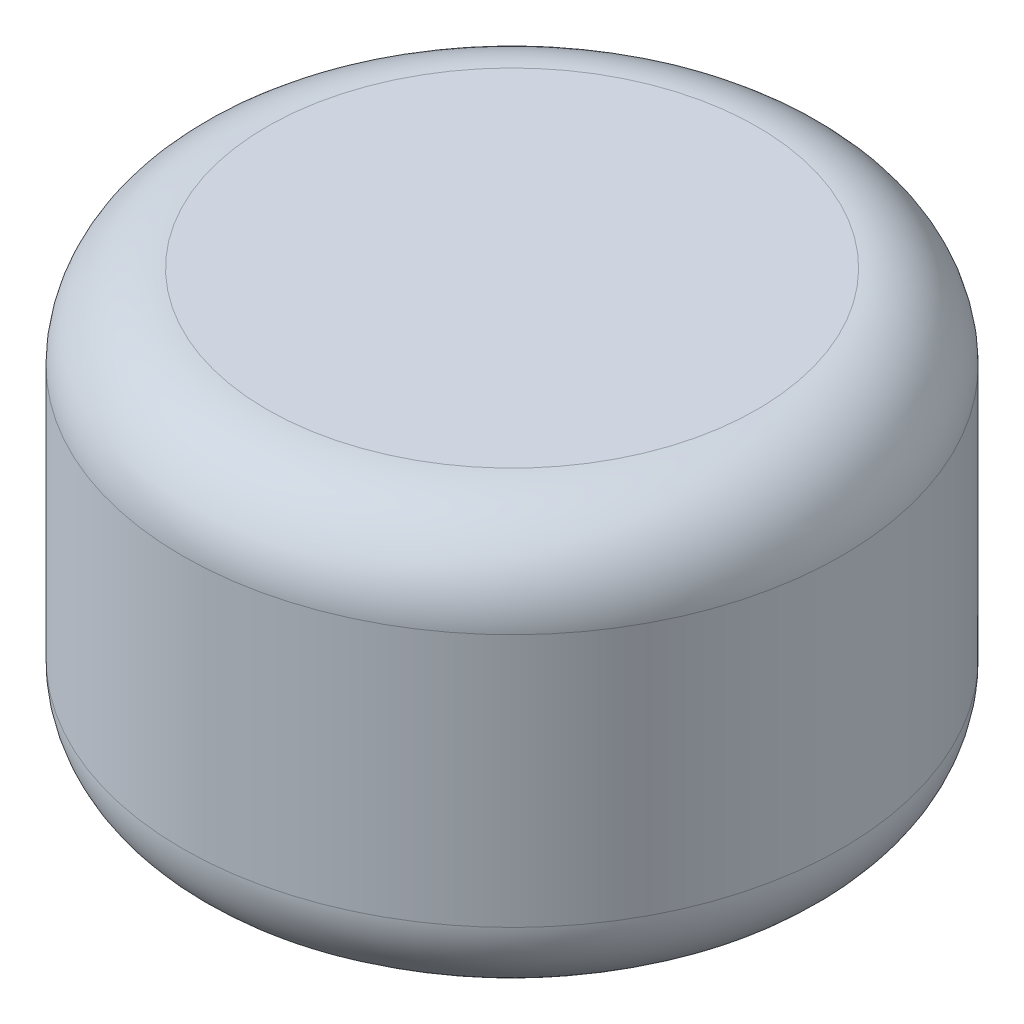
from build123d import *

# Parameters (mm, degrees)
SKETCH1_R           = 49.53
BOSS_EXTRUDE1_DEPTH = 63.5
FILLET1_R           = 12.7


with BuildPart() as part:
    # Sketch1 → Boss-Extrude1 (new body)
    with BuildSketch(Plane(origin=(0, 0, 0), x_dir=(1, 0, 0), z_dir=(0, 1, 0))):
        Circle(SKETCH1_R)
    extrude(amount=BOSS_EXTRUDE1_DEPTH)

    # Fillet1
    fillet1_edges = [part.edges().sort_by_distance(p)[0] for p in [
        (-49.53, 0, 0),
        (-49.53, 63.5, 0),
    ]]
    fillet(fillet1_edges, radius=FILLET1_R)


solid = part.part
